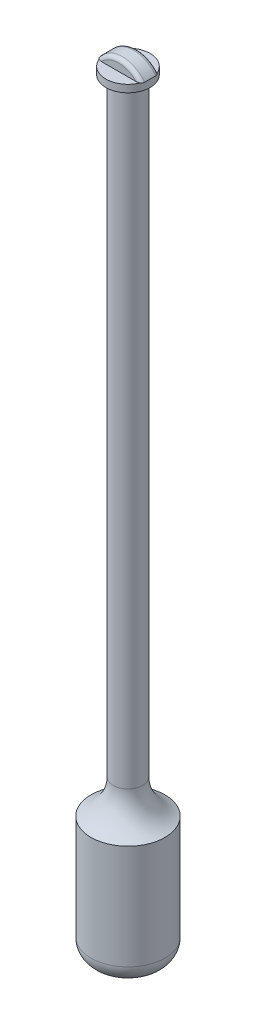
from build123d import *

# Parameters (mm, degrees)
BOSS_EXTRUDE1_DEPTH = 2.5
FILLET1_R           = 1


with BuildPart() as part:
    # Sketch1 → Revolve1 (revolve)
    with BuildSketch(Plane.XY, mode=Mode.PRIVATE) as revolve1_sk:
        with BuildLine():
            Line((0, 0), (5, 0))
            ThreePointArc((5, 0), (8.535533906, 1.464466094), (10, 5))
            Line((10, 5), (10, 33.285700302))
            ThreePointArc((10, 33.285700302), (5.625709026, 36.973401218), (3.989031047, 42.455631126))
            Line((3.989031047, 42.455631126), (3.989031047, 207))
            Line((3.989031047, 207), (6, 207))
            Line((6, 207), (6, 209))
            Line((6, 209), (0, 209))
            Line((0, 209), (0, 0))
        make_face()
    revolve(revolve1_sk.sketch.rotate(Axis((0, 0, 0), (0, -1, 0)), 90), axis=Axis((0, 0, 0), (0, -1, 0)))

    # Sketch2 → Boss-Extrude1 (add, symmetric)
    with BuildSketch(Plane.XY):
        with BuildLine():
            Line((-6, 209), (6, 209))
            ThreePointArc((6, 209), (0, 212), (-6, 209))
        make_face()
    extrude(amount=BOSS_EXTRUDE1_DEPTH, both=True)

    # Fillet1
    # the kernel refuses this fillet: 1 mm, written as the material it takes off along each edge
    with BuildSketch(Plane(origin=(0, 204.5, -2.5), x_dir=(0.9523393361832132, 0.3050406346015508, 0), z_dir=(0.3050406346015508, -0.9523393361832132, 0))) as fillet1_piece_1_section:
        with BuildLine():
            CenterArc((7.5 - FILLET1_R, FILLET1_R), FILLET1_R, 270, 90)
            Line((7.5 - FILLET1_R, 0), (7.5, 0))
            Line((7.5, 0), (7.5, FILLET1_R))
        make_face()
    fillet1_piece_1 = revolve(axis=Axis((0, 204.5, -2.5), (0, 0, 1)), revolution_arc=144.478782805, mode=Mode.PRIVATE)
    fillet1_piece_1 = split(fillet1_piece_1, bisect_by=Plane(origin=(5.716310171, 209, -2.240967586), z_dir=(0, 1, 0)), keep=Keep.TOP, mode=Mode.PRIVATE)
    add(fillet1_piece_1, mode=Mode.SUBTRACT)
    with BuildSketch(Plane(origin=(0, 204.5, 2.5), x_dir=(0.9523393361832132, 0.3050406346015508, 0), z_dir=(0.3050406346015508, -0.9523393361832132, 0))) as fillet1_piece_2_section:
        with BuildLine():
            CenterArc((7.5 - FILLET1_R, -FILLET1_R), FILLET1_R, 0, 90)
            Line((7.5, -FILLET1_R), (7.5, 0))
            Line((7.5, 0), (7.5 - FILLET1_R, 0))
        make_face()
    fillet1_piece_2 = revolve(axis=Axis((0, 204.5, 2.5), (0, 0, 1)), revolution_arc=144.478782805, mode=Mode.PRIVATE)
    fillet1_piece_2 = split(fillet1_piece_2, bisect_by=Plane(origin=(5.71631017, 209, 2.240967722), z_dir=(0, 1, 0)), keep=Keep.TOP, mode=Mode.PRIVATE)
    add(fillet1_piece_2, mode=Mode.SUBTRACT)


solid = part.part
